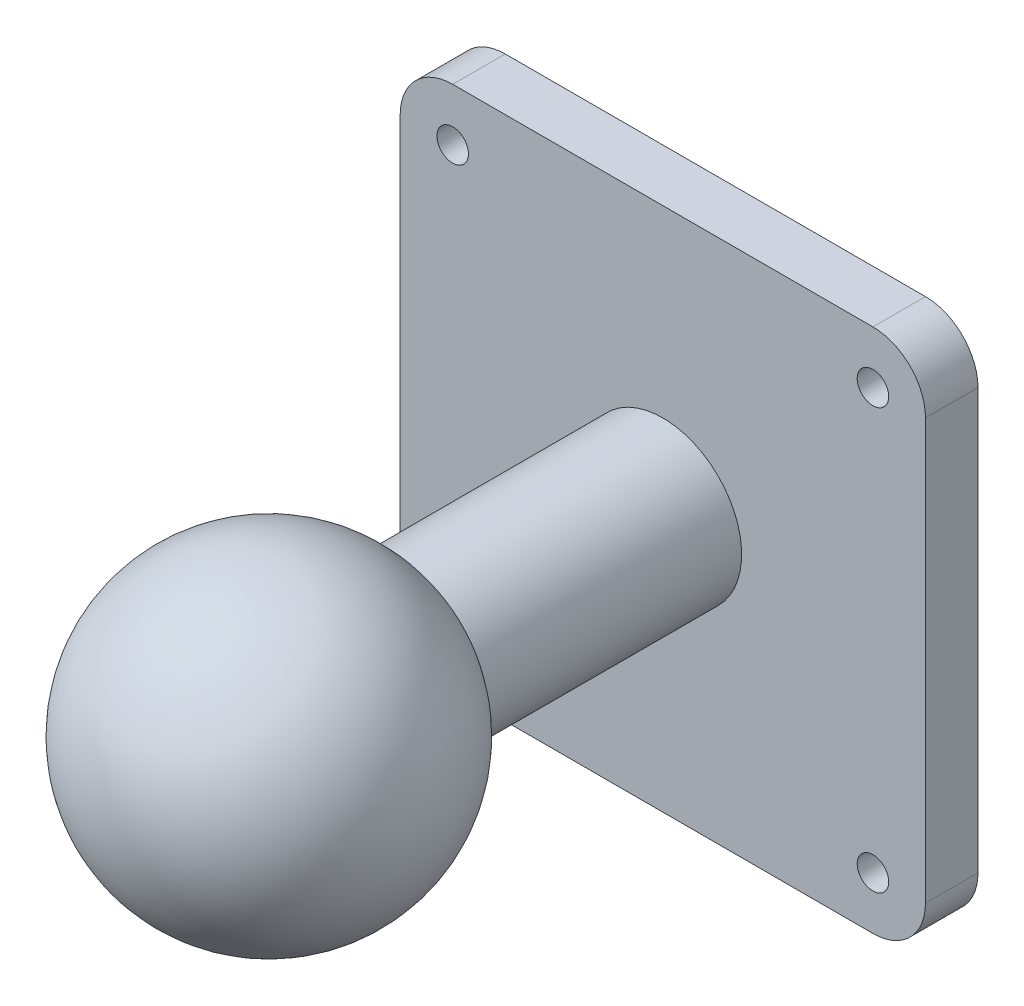
from build123d import *

# Parameters (mm, degrees)
CROQUIS1_W                   = 50
CROQUIS1_H                   = 50
SALIENTE_EXTRUIR1_DEPTH      = 5
SALIENTE_EXTRUIR2_REACH      = 65.295
SALIENTE_EXTRUIR2_END_RADIUS = 15
CROQUIS2_R                   = 7.5
CROQUIS4_R                   = 1.5
CORTAR_EXTRUIR1_DEPTH        = 5
REDONDEO1_R                  = 5


with BuildPart() as part:
    # Croquis1 → Saliente-Extruir1 (new body)
    with BuildSketch(Plane.XY):
        Rectangle(CROQUIS1_W, CROQUIS1_H)
    extrude(amount=SALIENTE_EXTRUIR1_DEPTH)



with BuildPart() as body_2:
    # Croquis3 → Revolución1 (revolve)
    with BuildSketch(Plane.XY.offset(42.5)):
        with BuildLine():
            Line((0, 15), (0, -15))
            ThreePointArc((0, -15), (15, 0), (0, 15))
        make_face()
    revolve(axis=Axis((0, 15, 42.5), (0, -1, 0)))


with BuildPart() as part_1:
    add(part.part)

    add(body_2.part)  # Saliente-Extruir2 merges body 2
    # Saliente-Extruir2: up to this sphere (the profile starts outside it)
    saliente_extruir2_end = Location((0, 0, 42.5)) * Sphere(SALIENTE_EXTRUIR2_END_RADIUS, mode=Mode.PRIVATE)
    # Croquis2 → Saliente-Extruir2 (add, up to the surface)
    with BuildSketch(Plane.XY.offset(5), mode=Mode.PRIVATE) as saliente_extruir2_sk1:
        Circle(CROQUIS2_R)
    saliente_extruir2_tool1 = extrude(saliente_extruir2_sk1.sketch, amount=SALIENTE_EXTRUIR2_REACH, mode=Mode.PRIVATE) - saliente_extruir2_end
    add(saliente_extruir2_tool1.solids().sort_by_distance((0, 0, 5))[0])

    # Croquis4 → Cortar-Extruir1 (cut)
    with BuildSketch(Plane.XY.offset(5)):
        with Locations((-20, 20)):
            Circle(CROQUIS4_R)
        with Locations((20, 20)):
            Circle(CROQUIS4_R)
        with Locations((20, -20)):
            Circle(CROQUIS4_R)
        with Locations((-20, -20)):
            Circle(CROQUIS4_R)
    extrude(amount=-CORTAR_EXTRUIR1_DEPTH, mode=Mode.SUBTRACT)

    # Redondeo1
    redondeo1_edges = [part_1.edges().sort_by_distance(p)[0] for p in [
        (25, -25, 2.5),
        (25, 25, 2.5),
        (-25, 25, 2.5),
        (-25, -25, 2.5),
    ]]
    fillet(redondeo1_edges, radius=REDONDEO1_R)


solid = part_1.part
